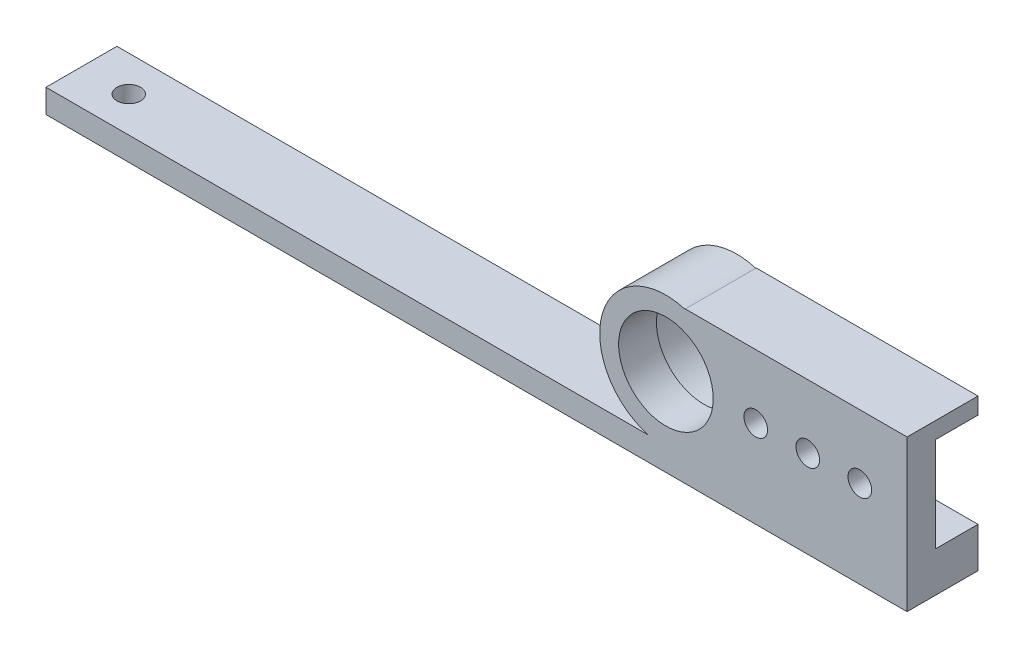
from build123d import *

# Parameters (mm, degrees)
SKETCH_1_W          = 40
SKETCH_1_H          = 20
EXTRUDE_1_DEPTH     = 6
SKETCH_2_R          = 2.5
CUT_EXTRUDE_1_DEPTH = 24.151673806
EXTRUDE_START       = -15
EXTRUDE_2_OUTLINE_R = 11
EXTRUDE_2_DEPTH     = 15
EXTRUDE_START_2     = -8
SKETCH_5_R          = 11
SKETCH_5_R_2        = 10
EXTRUDE_3_DEPTH     = 8
SKETCH_10_W         = 15
SKETCH_10_H         = 5
EXTRUDE_4_DEPTH     = 200
SKETCH_11_W         = 3.09493726
SKETCH_11_H         = 3.09493726
EXTRUDE_5_DEPTH     = 15
SKETCH_18_W         = 44.754670229
SKETCH_18_H         = 64.187168005
CUT_EXTRUDE_3_DEPTH = 184.131783151
SKETCH_19_R         = 2.5
CUT_EXTRUDE_4_DEPTH = 166.562236052


# Read off the part's stored shape, not the designer's step: 凸台-拉伸2
with BuildPart() as part:
    # 草图1 → 凸台-拉伸1 (new body)
    with BuildSketch(Plane.XY):
        Rectangle(SKETCH_1_W, SKETCH_1_H)
    extrude(amount=EXTRUDE_1_DEPTH)

    # 草图2 → 切除-拉伸1 (cut, through all)
    with BuildSketch(Plane.XY.offset(6)):
        with Locations((10, 0)):
            Circle(SKETCH_2_R)
        with Locations((-1, 0)):
            Circle(SKETCH_2_R)
        with Locations((-12, 0)):
            Circle(SKETCH_2_R)
    extrude(amount=-CUT_EXTRUDE_1_DEPTH, mode=Mode.SUBTRACT)

    # 凸台-拉伸2 outline → 凸台-拉伸2 (add)
    with BuildSketch(Plane.XY.offset(6).offset(EXTRUDE_START)):
        with BuildLine():
            Line((20, 10), (20, 13.5))
            Line((20, 13.5), (-26.893967141, 13.5))
            Line((-26.893967141, 13.5), (-26.893967141, 13.384337644))
            ThreePointArc((-26.893967141, 13.384337644), (-45, 0), (-26.893967141, -13.384337644))
            Line((-26.893967141, -13.384337644), (-26.893967141, -13.5))
            Line((-26.893967141, -13.5), (20, -13.5))
            Line((20, -13.5), (20, -10))
            Line((20, -10), (-20, -10))
            Line((-20, -10), (-20, -8.660254038))
            ThreePointArc((-20, -8.660254038), (-17, 0), (-20, 8.660254038))
            Line((-20, 8.660254038), (-20, 10))
            Line((-20, 10), (20, 10))
        make_face()
        with Locations((-31, 0)):
            Circle(EXTRUDE_2_OUTLINE_R, mode=Mode.SUBTRACT)
    extrude(amount=EXTRUDE_2_DEPTH)

    # 草图5 → 凸台-拉伸3 (add)
    with BuildSketch(Plane.XY.offset(6).offset(EXTRUDE_START_2)):
        with Locations((-31, 0)):
            Circle(SKETCH_5_R)
        with Locations((-31, 0)):
            Circle(SKETCH_5_R_2, mode=Mode.SUBTRACT)
    extrude(amount=EXTRUDE_3_DEPTH)

    # 草图10 → 凸台-拉伸4 (add)
    with BuildSketch(Plane(origin=(20, 0, 0), x_dir=(0, 0, -1), z_dir=(1, 0, 0))):
        with Locations((1.5, -16)):
            Rectangle(SKETCH_10_W, SKETCH_10_H)
    extrude(amount=-EXTRUDE_4_DEPTH)

    # 草图11 → 凸台-拉伸5 (add, through all)
    with BuildSketch(Plane.XY.offset(6)):
        with Locations((-27.071814196, -13.413570993)):
            Rectangle(SKETCH_11_W, SKETCH_11_H)
    extrude(amount=-EXTRUDE_5_DEPTH)

    # 草图18 → 切除-拉伸3 (cut, through all)
    with BuildSketch(Plane.XZ.offset(18.5)):
        with Locations((-184.468679753, -6.901085589)):
            Rectangle(SKETCH_18_W, SKETCH_18_H)
    extrude(amount=-CUT_EXTRUDE_3_DEPTH, mode=Mode.SUBTRACT)

    # 草图19 → 切除-拉伸4 (cut, through all)
    with BuildSketch(Plane.XZ.offset(18.5)):
        with Locations(Location((-152.091344638, -1.5, 0), (0, 0, 270))):
            Circle(SKETCH_19_R)
    extrude(amount=-CUT_EXTRUDE_4_DEPTH, mode=Mode.SUBTRACT)


solid = part.part
